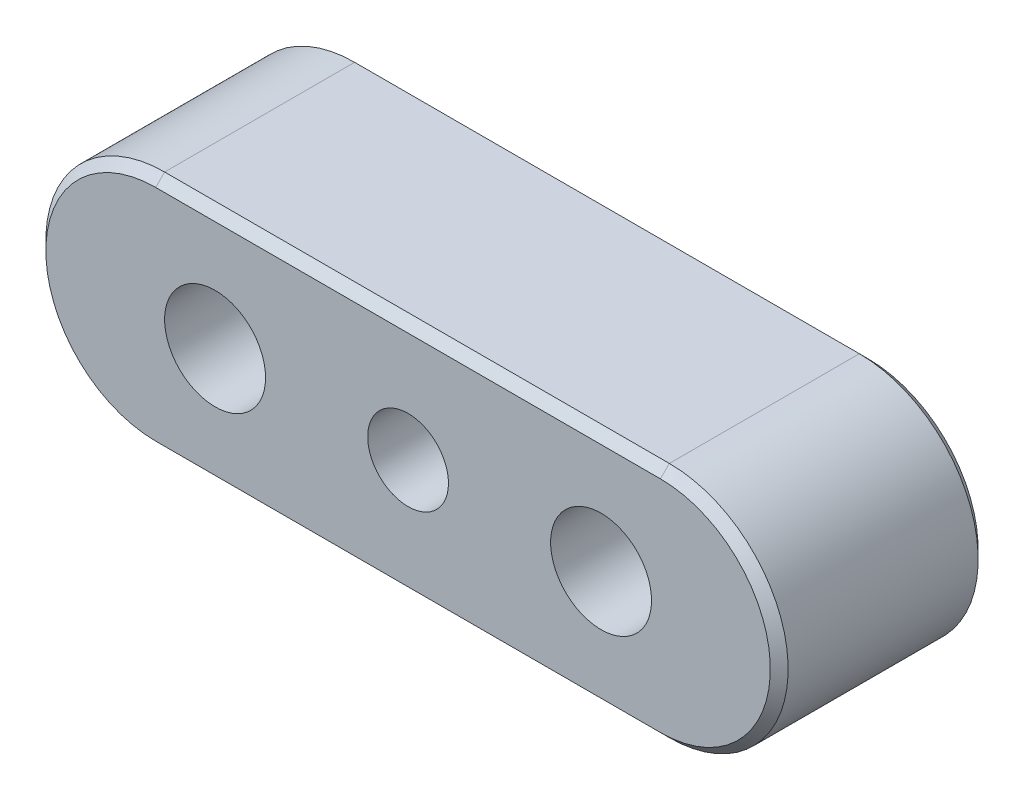
from build123d import *

# Parameters (mm, degrees)
BASEKEY_DEPTH    = 3.5
HOLE_DEPTH       = 22.662179022
HOLE_DEPTH_BACK  = 22.662179022
SKETCH2_R        = 1.36
SKETCH2_R_2      = 1.7
ENDCHAMFER_SIZE  = 0.3
ENDCHAMFER_SIZE2 = 0.519615242
SKETCH3_R        = 3
HOLE1_DEPTH      = 2.4
CHAMFER1_SIZE    = 0.3


with BuildPart() as part:
    # Sketch1 → BaseKey (new, symmetric)
    with BuildSketch(Plane.XY):
        with BuildLine():
            Line((-17, 4), (0, 4))
            ThreePointArc((0, 4), (4, 0), (0, -4))
            Line((0, -4), (-17, -4))
            ThreePointArc((-17, -4), (-21, 0), (-17, 4))
        make_face()
    extrude(amount=BASEKEY_DEPTH, both=True)

    # Sketch2 → Hole (cut, two sides: drawn at the far end of the back side and taken through both)
    with BuildSketch(Plane.XY.offset(-HOLE_DEPTH_BACK)):
        with Locations((-8.5, 0)):
            Circle(SKETCH2_R)
        with Locations((-2, 0)):
            Circle(SKETCH2_R_2)
        with Locations((-15, 0)):
            Circle(SKETCH2_R_2)
    extrude(amount=HOLE_DEPTH + HOLE_DEPTH_BACK, mode=Mode.SUBTRACT)

    # EndChamfer
    endchamfer_edges = [part.edges().sort_by_distance(p)[0] for p in [
        (-9.86, 0, -3.5),
    ]]
    endchamfer_side = [part.faces().sort_by_distance(p)[0] for p in [
        (-9.86, 0, 0),
    ]]
    chamfer(endchamfer_edges, length=ENDCHAMFER_SIZE, length2=ENDCHAMFER_SIZE2, reference=endchamfer_side[0])

    # Sketch3 → Hole1 (cut)
    with BuildSketch(Plane(origin=(-2.246013333, 3.133526554, -3.5), x_dir=(-1, 0, 0), z_dir=(0, 0, -1))):
        with Locations((-0.246013333, -3.133526554)):
            Circle(SKETCH3_R)
        with Locations((12.753986667, -3.133526554)):
            Circle(SKETCH3_R)
    extrude(amount=-HOLE1_DEPTH, mode=Mode.SUBTRACT)

    # Chamfer1
    chamfer1_edges = [part.edges().sort_by_distance(p)[0] for p in [
        (4, 0, -3.5),
        (-8.5, 4, -3.5),
        (-21, 0, -3.5),
        (-8.5, -4, -3.5),
        (4, 0, 3.5),
        (-8.5, -4, 3.5),
        (-21, 0, 3.5),
        (-8.5, 4, 3.5),
    ]]
    chamfer(chamfer1_edges, length=CHAMFER1_SIZE)


solid = part.part
